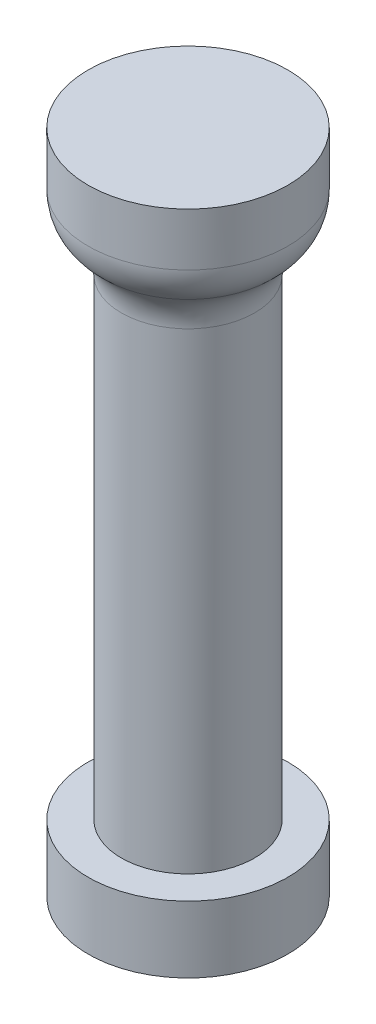
from build123d import *

# Parameters (mm, degrees)
SKETCH1_R           = 2
ROD_EXTRUSION_DEPTH = 15
SKETCH2_R           = 3
BOSS_EXTRUDE2_DEPTH = 3
FILLET3_R           = 1.5
FILLET4_R           = 1.5
INNER_START         = 2
SKETCH3_R           = 3
INNER_TIP_DEPTH     = 2


with BuildPart() as part:
    # Sketch1 → rod extrusion (new body)
    with BuildSketch(Plane(origin=(0, 0, 0), x_dir=(1, 0, 0), z_dir=(0, 1, 0))):
        with Locations(Location((0, 0, 0), (0, 0, 270))):
            Circle(SKETCH1_R)
    extrude(amount=ROD_EXTRUSION_DEPTH)

    # Sketch2 → Boss-Extrude2 (add)
    with BuildSketch(Plane(origin=(0, 15, 0), x_dir=(1, 0, 0), z_dir=(0, 1, 0))):
        with Locations(Location((0, 0, 0), (0, 0, 270))):
            Circle(SKETCH2_R)
    extrude(amount=BOSS_EXTRUDE2_DEPTH)

    # Fillet3
    # the kernel refuses this fillet: 1.5 mm, written as the material it takes off along each edge
    with BuildSketch(Plane(origin=(0, 15, 0), x_dir=(0, 0, 1), z_dir=(-1, 0, 0))) as fillet3_piece_1:
        with BuildLine():
            CenterArc((1.5, 1.414213562), FILLET3_R, 289.471220634, 70.528779366)
            Line((2, 0), (2.01, -0.028284271))
            ThreePointArc((2.01, -0.028284271), (2.5, -0.03), (3, -0.03))
            Line((3, -0.03), (3.03, 0))
            Line((3.03, 0), (3.03, 1.414213562))
            Line((3.03, 1.414213562), (3, 1.414213562))
        make_face()
    revolve(axis=Axis((0, 15, 0), (0, 1, 0)), mode=Mode.SUBTRACT)

    # Fillet4
    fillet4_edges = [part.edges().sort_by_distance(p)[0] for p in [
        (0, 15, -2),
    ]]
    fillet(fillet4_edges, radius=FILLET4_R)

    # Sketch3 → inner tip (add)
    with BuildSketch(Plane.XZ.offset(INNER_START)):
        with Locations(Location((0, 0, 0), (0, 0, 270))):
            Circle(SKETCH3_R)
    extrude(amount=-INNER_TIP_DEPTH)


solid = part.part
